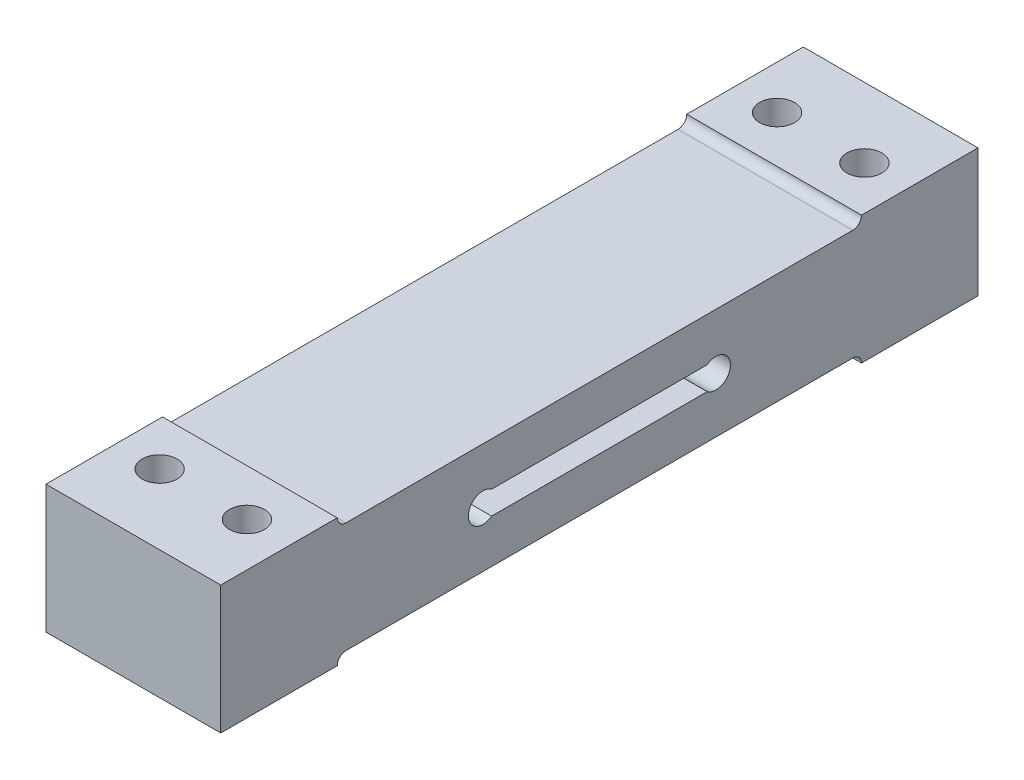
from build123d import *

# Parameters (mm, degrees)
SKETCH1_W           = 130
SKETCH1_H           = 22
BOSS_EXTRUDE1_DEPTH = 15
SKETCH2_R           = 3
CUT_EXTRUDE1_DEPTH  = 71.242437315
SKETCH3_W           = 90
SKETCH3_H           = 1.5
CUT_EXTRUDE2_DEPTH  = 30
FILLET1_R           = 1.5


with BuildPart() as part:
    # Sketch1 → Boss-Extrude1 (new, symmetric)
    with BuildSketch(Plane(origin=(0, 0, 0), x_dir=(0, 0, -1), z_dir=(1, 0, 0))):
        Rectangle(SKETCH1_W, SKETCH1_H)
        with BuildLine():
            Line((-18.5, 2), (18.5, 2))
            ThreePointArc((18.5, 2), (22.5, 0), (18.5, -2))
            Line((18.5, -2), (-18.5, -2))
            ThreePointArc((-18.5, -2), (-22.5, 0), (-18.5, 2))
        make_face(mode=Mode.SUBTRACT)
    extrude(amount=BOSS_EXTRUDE1_DEPTH, both=True)

    # Sketch2 → Cut-Extrude1 (cut, through all)
    with BuildSketch(Plane(origin=(0, 11, 0), x_dir=(1, 0, 0), z_dir=(0, 1, 0))):
        with Locations(Location((-7.5, 53, 0), (0, 0, 270))):
            Circle(SKETCH2_R)
        with Locations(Location((7.5, 53, 0), (0, 0, 270))):
            Circle(SKETCH2_R)
        with Locations(Location((-7.5, -53, 0), (0, 0, 270))):
            Circle(SKETCH2_R)
        with Locations(Location((7.5, -53, 0), (0, 0, 270))):
            Circle(SKETCH2_R)
    extrude(amount=-CUT_EXTRUDE1_DEPTH, mode=Mode.SUBTRACT)

    # Sketch3 → Cut-Extrude2 (cut)
    with BuildSketch(Plane(origin=(15, 0, 0), x_dir=(0, 0, -1), z_dir=(1, 0, 0))):
        with Locations((0, -10.25)):
            Rectangle(SKETCH3_W, SKETCH3_H)
        with Locations((0, 10.25)):
            Rectangle(SKETCH3_W, SKETCH3_H)
    extrude(amount=-CUT_EXTRUDE2_DEPTH, mode=Mode.SUBTRACT)

    # Fillet1
    fillet1_edges = [part.edges().sort_by_distance(p)[0] for p in [
        (0, -9.5, 45),
        (0, -9.5, -45),
        (0, 9.5, -45),
        (0, 9.5, 45),
    ]]
    fillet(fillet1_edges, radius=FILLET1_R - 0.0001)  # a hair under: the kernel refuses the full size


solid = part.part
